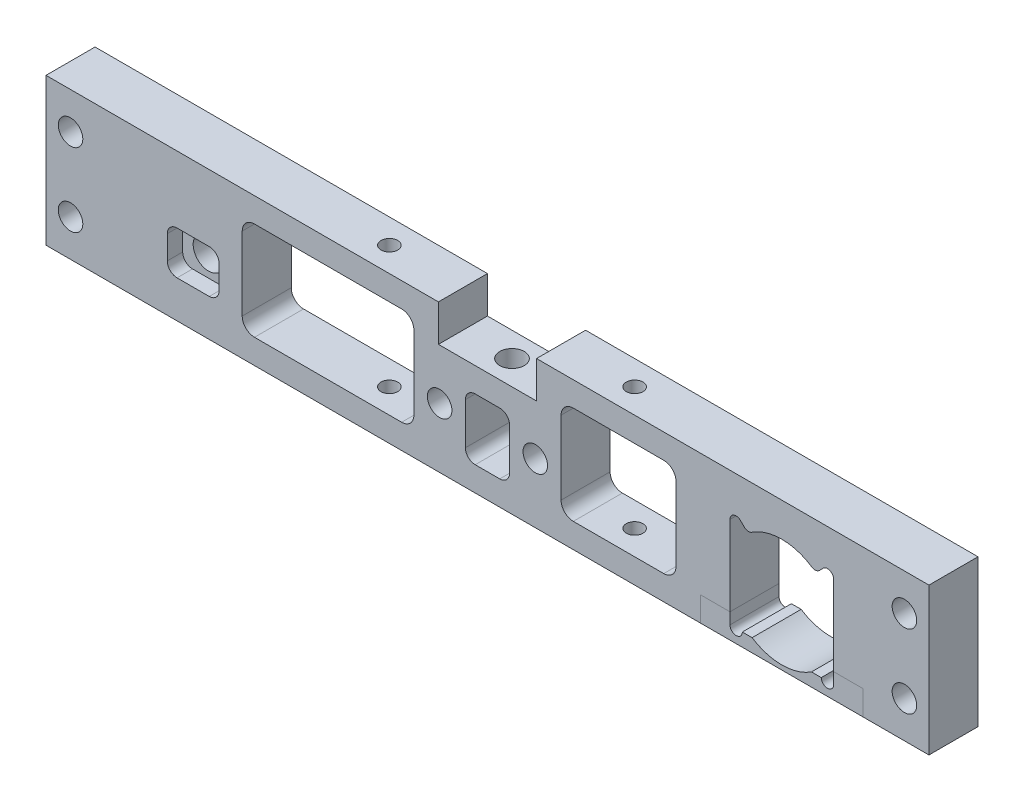
from build123d import *

# Parameters (mm, degrees)
SKETCH1_W                = 228.6
SKETCH1_H                = 38.1
BOSS_EXTRUDE1_DEPTH      = 12.7
CUT_EXTRUDE4_DEPTH       = 192.870900608
FILLET1_R                = 1.5875
SKETCH6_W                = 25.4
SKETCH6_H                = 9.525
CUT_EXTRUDE5_DEPTH       = 192.870900608
SKETCH7_W                = 11.43
SKETCH7_H                = 15.875
CUT_EXTRUDE6_DEPTH       = 192.870900608
SKETCH8_R                = 3.175
CUT_EXTRUDE7_DEPTH       = 6.35
SKETCH9_R                = 3.175
CUT_EXTRUDE8_DEPTH       = 192.870900608
SKETCH10_R               = 4.7625
CUT_EXTRUDE9_DEPTH       = 6.35
SURFACE_EXTRUDE1_1_BACK  = 12.7
SURFACE_EXTRUDE1_1_DEPTH = 12.7
SURFACE_EXTRUDE1_2_BACK  = 12.7
SURFACE_EXTRUDE1_2_DEPTH = 12.7
FILLET2_R                = 2.54
SKETCH12_R               = 1.4224
CUT_EXTRUDE10_DEPTH      = 15.24
CHAMFER1_SIZE            = 2.1082
CHAMFER1_SIZE2           = 1.832630301
CHAMFER2_SIZE            = 2.1082
CHAMFER2_SIZE2           = 1.832630301
SKETCH13_W               = 29.761064524
SKETCH13_H               = 25.4
SKETCH13_W_2             = 44.45
CUT_EXTRUDE11_DEPTH      = 192.870900608
FILLET3_R                = 3.175
SKETCH14_R               = 2.159
CUT_EXTRUDE12_DEPTH      = 195.687313403
SKETCH15_R               = 3.175
CUT_EXTRUDE13_DEPTH      = 192.870900608
SKETCH16_W               = 13.412933216
SKETCH16_H               = 11.176
CUT_EXTRUDE14_DEPTH      = 4.000000128
FILLET4_R                = 2.54
SKETCH17_R               = 3.175
CUT_EXTRUDE15_DEPTH      = 192.870900608
SKETCH18_R               = 4
CUT_EXTRUDE16_DEPTH      = 192.870900608


with BuildPart() as part:
    # Sketch1 → Boss-Extrude1 (new body)
    with BuildSketch(Plane.XY):
        with Locations((-76.2, 0)):
            Rectangle(SKETCH1_W, SKETCH1_H)
    extrude(amount=BOSS_EXTRUDE1_DEPTH)

    # Sketch5 → Cut-Extrude4 (cut, through all)
    with BuildSketch(Plane.XY.offset(12.7)):
        with BuildLine():
            Line((-8.772142836, 7.225167378), (-10.687223205, 9.140247747))
            ThreePointArc((-10.687223205, 9.140247747), (-12.431105504, 9.487127504), (-13.418935476, 8.008735476))
            Line((-13.418935476, 8.008735476), (-13.418935476, -15.628735476))
            ThreePointArc((-13.418935476, -15.628735476), (-11.818735476, -17.228935476), (-10.218535476, -15.628735476))
            Line((-10.218535476, -15.628735476), (-7.683937842, -15.628735476))
            ThreePointArc((-7.683937842, -15.628735476), (0, -17.907), (7.683937842, -15.628735476))
            Line((7.683937842, -15.628735476), (10.218535476, -15.628735476))
            ThreePointArc((10.218535476, -15.628735476), (11.818735476, -17.228935476), (13.418935476, -15.628735476))
            Line((13.418935476, -15.628735476), (13.418935476, 8.008735476))
            ThreePointArc((13.418935476, 8.008735476), (12.571582801, 9.420776887), (10.926920796, 9.337383893))
            Line((10.926920796, 9.337383893), (8.795831767, 7.206294864))
            ThreePointArc((8.795831767, 7.206294864), (0.015143788, 10.286991866), (-8.772142836, 7.225167378))
        make_face()
    extrude(amount=-CUT_EXTRUDE4_DEPTH, mode=Mode.SUBTRACT)

    # Fillet1
    fillet1_edges = [part.edges().sort_by_distance(p)[0] for p in [
        (-8.772142836, 7.225167378, 6.35),
        (8.795831767, 7.206294864, 6.35),
    ]]
    fillet(fillet1_edges, radius=FILLET1_R)

    # Sketch6 → Cut-Extrude5 (cut, through all)
    with BuildSketch(Plane.XY.offset(12.7)):
        with Locations((-76.2, 14.2875)):
            Rectangle(SKETCH6_W, SKETCH6_H)
    extrude(amount=-CUT_EXTRUDE5_DEPTH, mode=Mode.SUBTRACT)

    # Sketch7 → Cut-Extrude6 (cut, through all)
    with BuildSketch(Plane.XY.offset(12.7)):
        with Locations((-76.2, -4.7625)):
            Rectangle(SKETCH7_W, SKETCH7_H)
    extrude(amount=-CUT_EXTRUDE6_DEPTH, mode=Mode.SUBTRACT)

    # Sketch8 → Cut-Extrude7 (cut)
    with BuildSketch(Plane(origin=(0, 9.525, 0), x_dir=(1, 0, 0), z_dir=(0, 1, 0))):
        with Locations(Location((-76.2, -6.35, 0), (0, 0, 180))):
            Circle(SKETCH8_R)
    extrude(amount=-CUT_EXTRUDE7_DEPTH, mode=Mode.SUBTRACT)

    # Sketch9 → Cut-Extrude8 (cut, through all)
    with BuildSketch(Plane(origin=(0, 0, 0), x_dir=(-1, 0, 0), z_dir=(0, 0, -1))):
        with Locations((-31.75, 9.525)):
            Circle(SKETCH9_R)
        with Locations((-31.75, -9.525)):
            Circle(SKETCH9_R)
        with Locations((184.15, 9.525)):
            Circle(SKETCH9_R)
        with Locations((184.15, -9.525)):
            Circle(SKETCH9_R)
    extrude(amount=-CUT_EXTRUDE8_DEPTH, mode=Mode.SUBTRACT)

    # Sketch10 → Cut-Extrude9 (cut)
    with BuildSketch(Plane(origin=(0, 0, 0), x_dir=(-1, 0, 0), z_dir=(0, 0, -1))):
        with Locations((-31.75, 9.525)):
            Circle(SKETCH10_R)
        with Locations((-31.75, -9.525)):
            Circle(SKETCH10_R)
        with Locations((184.15, 9.525)):
            Circle(SKETCH10_R)
        with Locations((184.15, -9.525)):
            Circle(SKETCH10_R)
    extrude(amount=-CUT_EXTRUDE9_DEPTH, mode=Mode.SUBTRACT)


with BuildPart() as body_2:
    # Split1: the piece behind the surface
    add(part.part)
    # Surface-Extrude1: a surface, the sketch's curves swept straight by 12.7 mm
    with BuildLine(Plane(origin=(0, 0, 0), x_dir=(-1, 0, 0), z_dir=(0, 0, -1)).offset(-SURFACE_EXTRUDE1_1_BACK), mode=Mode.PRIVATE) as surface_extrude1_1_path:
        Line((-21.038935476, -19.05), (-21.038935476, -12.7))
        Line((-21.038935476, -12.7), (21.038935476, -12.7))
        Line((21.038935476, -12.7), (21.038935476, -19.05))
    surface_extrude1_1 = Shell.extrude(surface_extrude1_1_path.wire(), (0 * SURFACE_EXTRUDE1_1_DEPTH, 0 * SURFACE_EXTRUDE1_1_DEPTH, -1 * SURFACE_EXTRUDE1_1_DEPTH))
    split(bisect_by=surface_extrude1_1, keep=Keep.BOTTOM)


with BuildPart() as part_1:
    add(part.part)

    # Split1: split by a surface, the side it looks to stays
    # Surface-Extrude1: a surface, the sketch's curves swept straight by 12.7 mm
    with BuildLine(Plane(origin=(0, 0, 0), x_dir=(-1, 0, 0), z_dir=(0, 0, -1)).offset(-SURFACE_EXTRUDE1_2_BACK), mode=Mode.PRIVATE) as surface_extrude1_2_path:
        Line((-21.038935476, -19.05), (-21.038935476, -12.7))
        Line((-21.038935476, -12.7), (21.038935476, -12.7))
        Line((21.038935476, -12.7), (21.038935476, -19.05))
    surface_extrude1_2 = Shell.extrude(surface_extrude1_2_path.wire(), (0 * SURFACE_EXTRUDE1_2_DEPTH, 0 * SURFACE_EXTRUDE1_2_DEPTH, -1 * SURFACE_EXTRUDE1_2_DEPTH))
    split(bisect_by=surface_extrude1_2, keep=Keep.TOP)

    # Fillet2
    fillet2_edges = [part_1.edges().sort_by_distance(p)[0] for p in [
        (-70.485, -12.7, 6.35),
        (-81.915, -12.7, 6.35),
        (-81.915, 3.175, 6.35),
        (-70.485, 3.175, 6.35),
    ]]
    fillet(fillet2_edges, radius=FILLET2_R - 0.0001)  # a hair under: the kernel refuses the full size


with BuildPart() as cut_extrude10_tool:
    # Sketch12 → Cut-Extrude10 (new body)
    with BuildSketch(Plane.XZ.offset(19.05)):
        with Locations((-17.228935476, 6.35)):
            Circle(SKETCH12_R)
        with Locations((17.228935476, 6.35)):
            Circle(SKETCH12_R)
    extrude(amount=-CUT_EXTRUDE10_DEPTH)


with BuildPart() as part_2:
    add(part_1.part)

    # Cut-Extrude10: cut by cut_extrude10_tool
    add(cut_extrude10_tool.part, mode=Mode.SUBTRACT)

    # Sketch13 → Cut-Extrude11 (cut, through all)
    with BuildSketch(Plane(origin=(0, 0, 0), x_dir=(-1, 0, 0), z_dir=(0, 0, -1))):
        with Locations((42.269467738, 0)):
            Rectangle(SKETCH13_W, SKETCH13_H)
        with Locations((117.475, 0)):
            Rectangle(SKETCH13_W_2, SKETCH13_H)
    extrude(amount=-CUT_EXTRUDE11_DEPTH, mode=Mode.SUBTRACT)

    # Fillet3
    fillet3_edges = [part_2.edges().sort_by_distance(p)[0] for p in [
        (-57.15, 12.7, 6.35),
        (-57.15, -12.7, 6.35),
        (-27.388935476, -12.7, 6.35),
        (-27.388935476, 12.7, 6.35),
        (-95.25, -12.7, 6.35),
        (-95.25, 12.7, 6.35),
        (-139.7, 12.7, 6.35),
        (-139.7, -12.7, 6.35),
    ]]
    fillet(fillet3_edges, radius=FILLET3_R)

    # Sketch14 → Cut-Extrude12 (cut, through all)
    with BuildSketch(Plane(origin=(0, 19.05, 0), x_dir=(1, 0, 0), z_dir=(0, 1, 0))):
        with Locations(Location((-107.95, -6.35, 0), (0, 0, 270))):
            Circle(SKETCH14_R)
        with Locations(Location((-44.45, -6.35, 0), (0, 0, 270))):
            Circle(SKETCH14_R)
    extrude(amount=-CUT_EXTRUDE12_DEPTH, mode=Mode.SUBTRACT)

    # Sketch15 → Cut-Extrude13 (cut, through all)
    with BuildSketch(Plane(origin=(0, 0, 0), x_dir=(-1, 0, 0), z_dir=(0, 0, -1))):
        with Locations((152.4, -3.81)):
            Circle(SKETCH15_R)
    extrude(amount=-CUT_EXTRUDE13_DEPTH, mode=Mode.SUBTRACT)

    # Sketch16 → Cut-Extrude14 (cut)
    with BuildSketch(Plane.XY.offset(12.7)):
        with Locations((-152.4, -3.81)):
            Rectangle(SKETCH16_W, SKETCH16_H)
    extrude(amount=-CUT_EXTRUDE14_DEPTH, mode=Mode.SUBTRACT)

    # Fillet4
    fillet4_edges = [part_2.edges().sort_by_distance(p)[0] for p in [
        (-145.693533392, 1.778, 10.699999936),
        (-145.693533392, -9.398, 10.699999936),
        (-159.106466608, -9.398, 10.699999936),
        (-159.106466608, 1.778, 10.699999936),
    ]]
    fillet(fillet4_edges, radius=FILLET4_R)

    # Sketch17 → Cut-Extrude15 (cut, through all)
    with BuildSketch(Plane(origin=(0, 0, 0), x_dir=(-1, 0, 0), z_dir=(0, 0, -1))):
        with Locations((63.8175, -3.556)):
            Circle(SKETCH17_R)
        with Locations((88.5825, -3.556)):
            Circle(SKETCH17_R)
    extrude(amount=-CUT_EXTRUDE15_DEPTH, mode=Mode.SUBTRACT)

    # Sketch18 → Cut-Extrude16 (cut, through all)
    with BuildSketch(Plane(origin=(0, 0, 0), x_dir=(-1, 0, 0), z_dir=(0, 0, -1))):
        with Locations((152.4, -3.81)):
            Circle(SKETCH18_R)
    extrude(amount=-CUT_EXTRUDE16_DEPTH, mode=Mode.SUBTRACT)


with BuildPart() as body_2_1:
    add(body_2.part)

    # Cut-Extrude10: cut by cut_extrude10_tool
    add(cut_extrude10_tool.part, mode=Mode.SUBTRACT)

    # Chamfer1
    chamfer1_edges = [body_2_1.edges().sort_by_distance(p)[0] for p in [
        (15.806535476, -19.05, 6.35),
    ]]
    chamfer1_side = [body_2_1.faces().sort_by_distance(p)[0] for p in [
        (15.806535476, -15.875, 6.35),
    ]]
    chamfer(chamfer1_edges, length=CHAMFER1_SIZE, length2=CHAMFER1_SIZE2, reference=chamfer1_side[0])

    # Chamfer2
    chamfer2_edges = [body_2_1.edges().sort_by_distance(p)[0] for p in [
        (-18.651335476, -19.05, 6.35),
    ]]
    chamfer2_side = [body_2_1.faces().sort_by_distance(p)[0] for p in [
        (-18.651335476, -15.875, 6.35),
    ]]
    chamfer(chamfer2_edges, length=CHAMFER2_SIZE, length2=CHAMFER2_SIZE2, reference=chamfer2_side[0])


solid = Compound([part_2.part, body_2_1.part])
